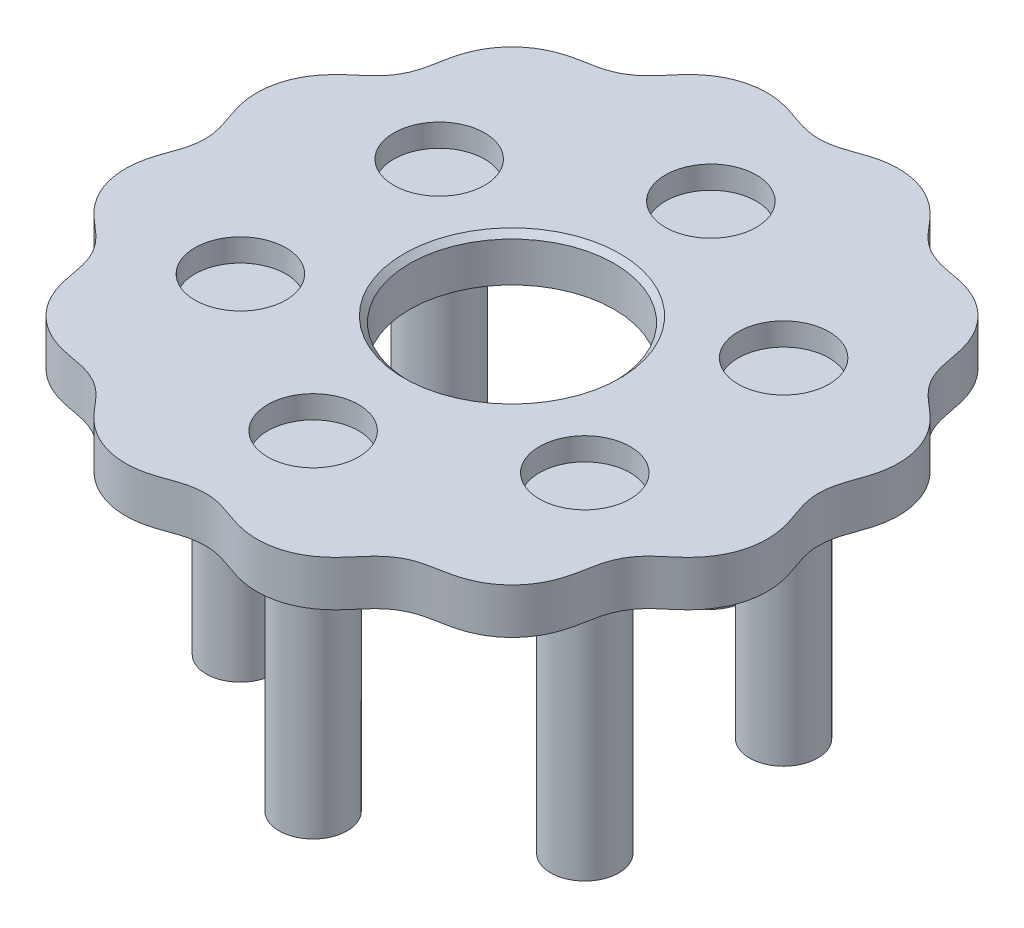
from build123d import *

# Parameters (mm, degrees)
BOSS_EXTRUDE1_DEPTH = 4
SKETCH2_R           = 9
CUT_EXTRUDE1_DEPTH  = 4
SKETCH3_R           = 4
CUT_EXTRUDE2_DEPTH  = 2
CHAMFER1_SIZE       = 0.5
SKETCH4_R           = 3
BOSS_EXTRUDE2_DEPTH = 25
FILLET1_R           = 1.5


# Read off the part's stored shape, not the designer's step: Boss-Extrude1
with BuildPart() as part:
    # Boss-Extrude1 outline → Boss-Extrude1 (new body)
    with BuildSketch(Plane(origin=(0, 0, 0), x_dir=(1, 0, 0), z_dir=(0, 1, 0))):
        with BuildLine():
            Line((27, 0), (27.000001572, 0.004099997))
            add(Edge.make_bspline(
                [(27.000001572, 0.004099997), (27.000024448, 0.033939281), (27.000530427, 0.078733201), (27.002159239, 0.152753864), (27.007926019, 0.3061854), (27.019803238, 0.486134544), (27.044236171, 0.710209832), (27.08843343, 0.99468093), (27.145764302, 1.271144393), (27.232171798, 1.616745756), (27.356073412, 2.02396201), (27.521000906, 2.493508038), (27.716272452, 3.02678805), (27.897237423, 3.565701085), (28.064221926, 4.170608775), (28.193001106, 4.845542448), (28.274636512, 5.79026898), (28.187877209, 6.993819653), (27.809790294, 8.350417847), (27.082867808, 9.649802868), (26.183929614, 10.673877959), (25.235812527, 11.473780228), (24.370354006, 12.193123574), (23.619060558, 13.040559519), (23.061829575, 14.027974655), (22.722509608, 15.107940943), (22.540115396, 16.217941522), (22.310627604, 17.43749212), (21.854593687, 18.721724418), (21.076795453, 19.984079854), (19.941886401, 21.109997947), (18.673404279, 21.877764394), (17.38582278, 22.324025244), (16.165446962, 22.547688138), (15.055851496, 22.733997898), (13.978757745, 23.083213842), (12.99714314, 23.650593216), (12.156847243, 24.409493008), (11.441020578, 25.277508431), (10.636703091, 26.222217097), (9.605789274, 27.113425941), (8.306103534, 27.827098161), (6.763256705, 28.245828875), (5.281094376, 28.287123159), (3.941085326, 28.038974558), (2.77039276, 27.62740848), (1.717761904, 27.230689313), (0.612584807, 26.985514684), (-0.521165891, 26.975495221), (-1.63049252, 27.203396622), (-2.686012173, 27.593622942), (-3.853010553, 28.014301607), (-5.189544443, 28.279782546), (-6.678365913, 28.258537364), (-8.238559851, 27.855810786), (-9.559200101, 27.147571895), (-10.609894266, 26.250958295), (-11.426126663, 25.29667015), (-12.147556588, 24.418443199), (-12.995530871, 23.650473301), (-13.987888625, 23.078054409), (-15.077182613, 22.728437444), (-16.19849739, 22.543076542), (-17.432988943, 22.312886202), (-18.734564151, 21.850507376), (-20.007760124, 21.060147962), (-21.135929645, 19.909659005), (-21.897967172, 18.63046337), (-22.335575088, 17.340005427), (-22.554344619, 16.118960967), (-22.744504016, 15.00977844), (-23.102563793, 13.935358019), (-23.678884788, 12.958963568), (-24.444361726, 12.124983159), (-25.314412694, 11.411968505), (-26.255901422, 10.60354088), (-27.140211848, 9.56661709), (-27.844741826, 8.261952815), (-28.252595633, 6.716195557), (-28.283483847, 5.233779265), (-28.02635931, 3.895531876), (-27.60997034, 2.726782849), (-27.216449027, 1.67272244), (-26.980139595, 0.565370052), (-26.980474187, -0.568422897), (-27.217360546, -1.675636661), (-27.611098664, -2.729600507), (-28.027183298, -3.898472997), (-28.283728903, -5.236836375), (-28.252168407, -6.719238227), (-27.843610955, -8.264810031), (-27.138488985, -9.569154166), (-26.253730695, -10.605690826), (-25.312028672, -11.413847459), (-24.442102548, -12.127035027), (-23.677046205, -12.961423213), (-23.101301577, -13.938157258), (-22.743815495, -15.012754256), (-22.553915449, -16.121964922), (-22.334837666, -17.34296826), (-21.896670407, -18.633242382), (-21.134053807, -19.912092302), (-20.00536007, -21.06206781), (-18.731806288, -21.851849103), (-17.430034502, -22.313659592), (-16.19549609, -22.543507448), (-15.074206005, -22.729094793), (-13.985080986, -23.079285719), (-12.993060357, -23.652288656), (-12.145498663, -24.42069207), (-11.424252904, -25.299053941), (-10.607747583, -26.253130508), (-9.556659448, -27.149289793), (-8.23569736, -27.856929805), (-6.675320744, -28.258945705), (-5.186489321, -28.279516523), (-3.85007581, -28.013459209), (-2.683196056, -27.592492668), (-1.627571272, -27.202504562), (-0.518110613, -26.975188118), (0.615634296, -26.985876537), (1.720668629, -27.231619492), (2.773211959, -27.628533705), (3.944032474, -28.039779895), (5.284152953, -28.287347119), (6.766296625, -28.245380094), (8.308952362, -27.825947245), (9.608314539, -27.111685537), (10.638838498, -26.220033221), (11.442896635, -25.275122476), (12.158914933, -24.407246222), (12.999619336, -23.648776549), (13.981568641, -23.081976643), (15.058830974, -22.733329752), (16.168451287, -22.547256528), (17.388781942, -22.323268693), (18.676174537, -21.876448471), (19.944308098, -21.108107003), (21.078704809, -19.98167216), (21.855929835, -18.718964056), (22.311404563, -17.43453731), (22.540550691, -16.214937479), (22.723156568, -15.104958367), (23.063039846, -14.02515248), (23.620853175, -13.038066251), (24.372586568, -12.191039395), (25.238199473, -11.471905983), (26.186127024, -10.671759321), (27.084626542, -9.647288981), (27.810987259, -8.347530847), (28.188464813, -6.990666987), (28.27465216, -5.786972017), (28.192540962, -4.842140507), (28.063427098, -4.16720549), (27.896172741, -3.562218272), (27.737681672, -3.090771227), (27.59295323, -2.689915261), (27.473046955, -2.355596024), (27.380165946, -2.087067057), (27.292990208, -1.816594021), (27.213872001, -1.543652209), (27.153510714, -1.302382782), (27.10915909, -1.093914746), (27.077542429, -0.919236466), (27.055598892, -0.778657943), (27.03712787, -0.637409177), (27.022230728, -0.497376741), (27.012393312, -0.37537519), (27.00628274, -0.263641883), (27.002044312, -0.148526868), (27.000471765, -0.074622861), (27, -0.029843366), (27, 0)],
                knots=[0.079864449, 0.079864449, 0.079864449, 0.079864449, 0.079864449, 0.080511074, 0.080834387, 0.0811577, 0.08245095, 0.083744201, 0.085037451, 0.086330702, 0.087623952, 0.090210454, 0.092796955, 0.095383456, 0.097969957, 0.100556458, 0.104216614, 0.10787677, 0.115197083, 0.122406218, 0.129615353, 0.1347366, 0.139857848, 0.144979096, 0.150100344, 0.155221409, 0.160342475, 0.16546354, 0.170584606, 0.177793672, 0.185002738, 0.192211845, 0.199420952, 0.20454211, 0.209663268, 0.214784426, 0.219905584, 0.225026733, 0.230147881, 0.23526903, 0.240390179, 0.247599282, 0.254808385, 0.262017456, 0.269226526, 0.2743476, 0.279468674, 0.284589748, 0.289710821, 0.29483206, 0.299953298, 0.305074536, 0.310195775, 0.317404907, 0.324614039, 0.331935362, 0.339256686, 0.344430392, 0.349604098, 0.354777804, 0.35995151, 0.365125221, 0.370298931, 0.375472642, 0.380646352, 0.387967672, 0.395288992, 0.402498127, 0.409707261, 0.414828507, 0.419949753, 0.425070999, 0.430192244, 0.435313312, 0.440434379, 0.445555446, 0.450676513, 0.45788558, 0.465094647, 0.472303753, 0.47951286, 0.484634016, 0.489755172, 0.494876328, 0.499997484, 0.505118635, 0.510239785, 0.515360936, 0.520482086, 0.52769119, 0.534900294, 0.542109364, 0.549318434, 0.554439506, 0.559560578, 0.56468165, 0.569802722, 0.574923962, 0.580045202, 0.585166443, 0.590287683, 0.597496816, 0.604705949, 0.612027271, 0.619348593, 0.6245223, 0.629696008, 0.634869715, 0.640043422, 0.645217132, 0.650390841, 0.65556455, 0.66073826, 0.668059581, 0.675380901, 0.682590035, 0.689799169, 0.694920413, 0.700041657, 0.705162901, 0.710284145, 0.715405214, 0.720526283, 0.725647352, 0.73076842, 0.737977488, 0.745186556, 0.752395662, 0.759604767, 0.764725921, 0.769847076, 0.77496823, 0.780089384, 0.785210537, 0.790331689, 0.795452841, 0.800573994, 0.807783099, 0.814992203, 0.822201272, 0.829410341, 0.834531411, 0.839652482, 0.844773552, 0.849894623, 0.855015865, 0.860137107, 0.865258349, 0.870379591, 0.877588724, 0.884797858, 0.892119179, 0.89577984, 0.899440501, 0.902027355, 0.904614209, 0.907201063, 0.908494491, 0.909787918, 0.911081345, 0.912374772, 0.913668199, 0.914961626, 0.915608339, 0.916255053, 0.916901767, 0.91754848, 0.918195194, 0.918841907, 0.919165264, 0.919488621, 0.920135334, 0.920135334, 0.920135334, 0.920135334, 0.920135334], degree=4))
        make_face()
    extrude(amount=BOSS_EXTRUDE1_DEPTH)

    # Sketch2 → Cut-Extrude1 (cut)
    with BuildSketch(Plane(origin=(0, 4, 0), x_dir=(1, 0, 0), z_dir=(0, 1, 0))):
        with Locations(Location((0, 0, 0), (0, 0, 270))):
            Circle(SKETCH2_R)
    extrude(amount=-CUT_EXTRUDE1_DEPTH, mode=Mode.SUBTRACT)

    # Sketch3 → Cut-Extrude2 (cut)
    with BuildSketch(Plane(origin=(0, 4, 0), x_dir=(1, 0, 0), z_dir=(0, 1, 0))):
        with Locations(Location((0, 17.5, 0), (0, 0, 270))):
            Circle(SKETCH3_R)
        with Locations(Location((15.155444566, 8.75, 0), (0, 0, 270))):
            Circle(SKETCH3_R)
        with Locations(Location((15.155444566, -8.75, 0), (0, 0, 270))):
            Circle(SKETCH3_R)
        with Locations(Location((0, -17.5, 0), (0, 0, 270))):
            Circle(SKETCH3_R)
        with Locations(Location((-15.155444566, -8.75, 0), (0, 0, 270))):
            Circle(SKETCH3_R)
        with Locations(Location((-15.155444566, 8.75, 0), (0, 0, 270))):
            Circle(SKETCH3_R)
    extrude(amount=-CUT_EXTRUDE2_DEPTH, mode=Mode.SUBTRACT)

    # Chamfer1
    chamfer1_edges = [part.edges().sort_by_distance(p)[0] for p in [
        (0, 4, -9),
    ]]
    chamfer(chamfer1_edges, length=CHAMFER1_SIZE)

    # Sketch4 → Boss-Extrude2 (add)
    with BuildSketch(Plane.XZ):
        with Locations(Location((0, 17.5, 0), (0, 0, 270))):
            Circle(SKETCH4_R)
        with Locations(Location((15.155444566, 8.75, 0), (0, 0, 270))):
            Circle(SKETCH4_R)
        with Locations(Location((15.155444566, -8.75, 0), (0, 0, 270))):
            Circle(SKETCH4_R)
        with Locations(Location((0, -17.5, 0), (0, 0, 270))):
            Circle(SKETCH4_R)
        with Locations(Location((-15.155444566, -8.75, 0), (0, 0, 270))):
            Circle(SKETCH4_R)
        with Locations(Location((-15.155444566, 8.75, 0), (0, 0, 270))):
            Circle(SKETCH4_R)
    extrude(amount=BOSS_EXTRUDE2_DEPTH)

    # Fillet1
    fillet1_edges = [part.edges().sort_by_distance(p)[0] for p in [
        (0, 0, 20.5),
        (-15.155444566, 0, 11.75),
        (-15.155444566, 0, -5.75),
        (0, 0, -14.5),
        (15.155444566, 0, -5.75),
        (15.155444566, 0, 11.75),
    ]]
    fillet(fillet1_edges, radius=FILLET1_R)


solid = part.part
